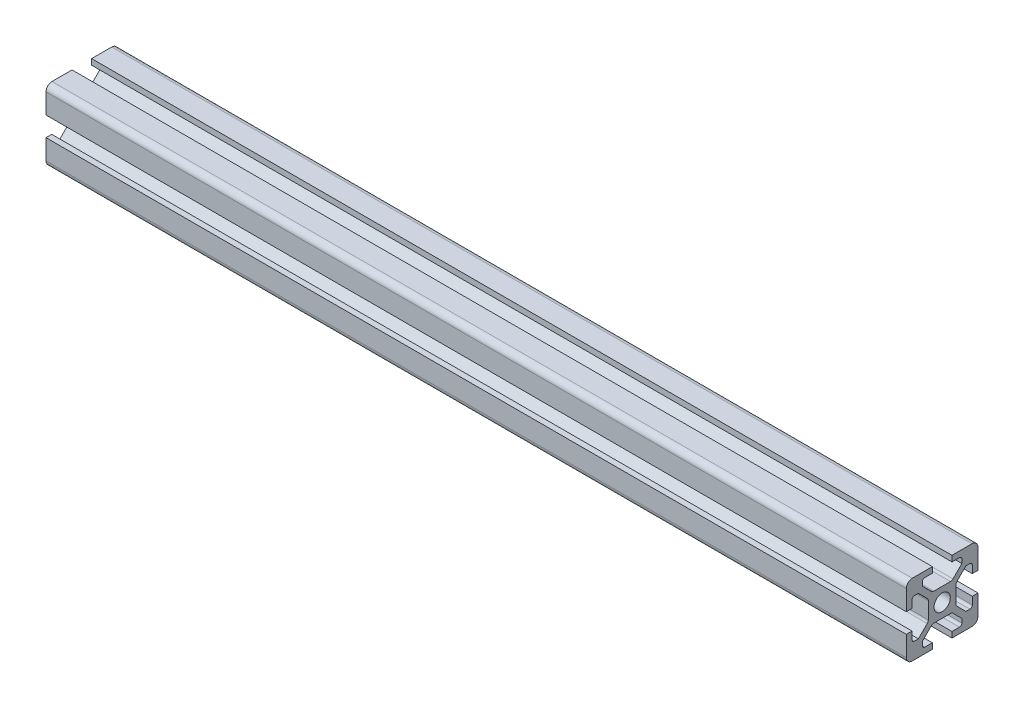
from build123d import *
from build123d.topology import SkipClean

# Parameters (mm, degrees)
SKETCH1_R           = 3.4
BOSS_EXTRUDE2_DEPTH = 100
FILLET5_R           = 2.5
FILLET6_R           = 1.5
FILLET7_R           = 1.5
FILLET8_R           = 1
SKETCH3_R           = 3.4
BOSS_EXTRUDE3_DEPTH = 140
SKETCH7_R           = 3.4
BOSS_EXTRUDE4_DEPTH = 120


with BuildPart() as part:
    # Sketch1 → Boss-Extrude2 (new body)
    with BuildSketch(Plane(origin=(0, 0, 0), x_dir=(0, 0, -1), z_dir=(1, 0, 0))):
        Polygon((10.9, 0), (10.9, 2.4), (6.75, 2.4), (6.75, 5.05), (10.9, 9.2), (19.1, 9.2), (23.25, 5.05), (23.25, 2.4), (19.1, 2.4), (19.1, 0), (30, 0), (30, 10.9), (27.6, 10.9), (27.6, 6.75), (24.95, 6.75), (20.8, 10.9), (20.8, 19.1), (24.95, 23.25), (27.6, 23.25), (27.6, 19.1), (30, 19.1), (30, 30), (19.1, 30), (19.1, 27.6), (23.25, 27.6), (23.25, 24.95), (19.1, 20.8), (10.9, 20.8), (6.75, 24.95), (6.75, 27.6), (10.9, 27.6), (10.9, 30), (0, 30), (0, 19.1), (2.4, 19.1), (2.4, 23.25), (5.05, 23.25), (9.2, 19.1), (9.2, 10.9), (5.05, 6.75), (2.4, 6.75), (2.4, 10.9), (0, 10.9), (0, 0), align=None)
        with Locations((15, 15)):
            Circle(SKETCH1_R, mode=Mode.SUBTRACT)
    extrude(amount=BOSS_EXTRUDE2_DEPTH)

    # Fillet5
    fillet5_edges = [part.edges().sort_by_distance(p)[0] for p in [
        (50, 0, -30),
        (50, 30, -30),
        (50, 0, 0),
        (50, 30, 0),
    ]]
    fillet(fillet5_edges, radius=FILLET5_R)

    # Fillet6
    fillet6_edges = [part.edges().sort_by_distance(p)[0] for p in [
        (50, 19.1, -20.8),
        (50, 10.9, -20.8),
        (50, 9.2, -10.9),
        (50, 9.2, -19.1),
        (50, 10.9, -9.2),
        (50, 19.1, -9.2),
    ]]
    fillet(fillet6_edges, radius=FILLET6_R)

    # Fillet7
    fillet7_edges = [part.edges().sort_by_distance(p)[0] for p in [
        (50, 20.8, -19.1),
        (50, 20.8, -10.9),
    ]]
    fillet(fillet7_edges, radius=FILLET7_R)

    # Fillet8
    fillet8_edges = [part.edges().sort_by_distance(p)[0] for p in [
        (50, 23.25, -2.4),
        (50, 27.6, -6.75),
        (50, 27.6, -23.25),
        (50, 23.25, -27.6),
        (50, 6.75, -27.6),
        (50, 2.4, -23.25),
        (50, 2.4, -6.75),
        (50, 6.75, -2.4),
    ]]
    fillet(fillet8_edges, radius=FILLET8_R)

    # Sketch3 → Boss-Extrude3 (add)
    with BuildSketch(Plane(origin=(0, 0, 0), x_dir=(0, 0, -1), z_dir=(1, 0, 0))):
        with BuildLine():
            Line((10.9, 27.6), (10.9, 30))
            Line((10.9, 30), (2.5, 30))
            ThreePointArc((2.5, 30), (0.732233047, 29.267766953), (0, 27.5))
            Line((0, 27.5), (0, 19.1))
            Line((0, 19.1), (2.4, 19.1))
            Line((2.4, 19.1), (2.4, 22.25))
            ThreePointArc((2.4, 22.25), (2.692893219, 22.957106781), (3.4, 23.25))
            Line((3.4, 23.25), (5.05, 23.25))
            Line((5.05, 23.25), (8.760660172, 19.539339828))
            ThreePointArc((8.760660172, 19.539339828), (9.085819299, 19.052704805), (9.2, 18.478679656))
            Line((9.2, 18.478679656), (9.2, 11.521320344))
            ThreePointArc((9.2, 11.521320344), (9.085819299, 10.947295195), (8.760660172, 10.460660172))
            Line((8.760660172, 10.460660172), (5.05, 6.75))
            Line((5.05, 6.75), (3.4, 6.75))
            ThreePointArc((3.4, 6.75), (2.692893219, 7.042893219), (2.4, 7.75))
            Line((2.4, 7.75), (2.4, 10.9))
            Line((2.4, 10.9), (0, 10.9))
            Line((0, 10.9), (0, 2.5))
            ThreePointArc((0, 2.5), (0.732233047, 0.732233047), (2.5, 0))
            Line((2.5, 0), (10.9, 0))
            Line((10.9, 0), (10.9, 2.4))
            Line((10.9, 2.4), (7.75, 2.4))
            ThreePointArc((7.75, 2.4), (7.042893219, 2.692893219), (6.75, 3.4))
            Line((6.75, 3.4), (6.75, 5.05))
            Line((6.75, 5.05), (10.460660172, 8.760660172))
            ThreePointArc((10.460660172, 8.760660172), (10.947295195, 9.085819299), (11.521320344, 9.2))
            Line((11.521320344, 9.2), (18.478679656, 9.2))
            ThreePointArc((18.478679656, 9.2), (19.052704805, 9.085819299), (19.539339828, 8.760660172))
            Line((19.539339828, 8.760660172), (23.25, 5.05))
            Line((23.25, 5.05), (23.25, 3.4))
            ThreePointArc((23.25, 3.4), (22.957106781, 2.692893219), (22.25, 2.4))
            Line((22.25, 2.4), (19.1, 2.4))
            Line((19.1, 2.4), (19.1, 0))
            Line((19.1, 0), (27.5, 0))
            ThreePointArc((27.5, 0), (29.267766953, 0.732233047), (30, 2.5))
            Line((30, 2.5), (30, 10.9))
            Line((30, 10.9), (27.6, 10.9))
            Line((27.6, 10.9), (27.6, 7.75))
            ThreePointArc((27.6, 7.75), (27.307106781, 7.042893219), (26.6, 6.75))
            Line((26.6, 6.75), (24.95, 6.75))
            Line((24.95, 6.75), (21.239339828, 10.460660172))
            ThreePointArc((21.239339828, 10.460660172), (20.914180701, 10.947295195), (20.8, 11.521320344))
            Line((20.8, 11.521320344), (20.8, 18.478679656))
            ThreePointArc((20.8, 18.478679656), (20.914180701, 19.052704805), (21.239339828, 19.539339828))
            Line((21.239339828, 19.539339828), (24.95, 23.25))
            Line((24.95, 23.25), (26.6, 23.25))
            ThreePointArc((26.6, 23.25), (27.307106781, 22.957106781), (27.6, 22.25))
            Line((27.6, 22.25), (27.6, 19.1))
            Line((27.6, 19.1), (30, 19.1))
            Line((30, 19.1), (30, 27.5))
            ThreePointArc((30, 27.5), (29.267766953, 29.267766953), (27.5, 30))
            Line((27.5, 30), (19.1, 30))
            Line((19.1, 30), (19.1, 27.6))
            Line((19.1, 27.6), (22.25, 27.6))
            ThreePointArc((22.25, 27.6), (22.957106781, 27.307106781), (23.25, 26.6))
            Line((23.25, 26.6), (23.25, 24.95))
            Line((23.25, 24.95), (19.539339828, 21.239339828))
            ThreePointArc((19.539339828, 21.239339828), (19.052704805, 20.914180701), (18.478679656, 20.8))
            Line((18.478679656, 20.8), (11.521320344, 20.8))
            ThreePointArc((11.521320344, 20.8), (10.947295195, 20.914180701), (10.460660172, 21.239339828))
            Line((10.460660172, 21.239339828), (6.75, 24.95))
            Line((6.75, 24.95), (6.75, 26.6))
            ThreePointArc((6.75, 26.6), (7.042893219, 27.307106781), (7.75, 27.6))
            Line((7.75, 27.6), (10.9, 27.6))
        make_face()
        with Locations((15, 15)):
            Circle(SKETCH3_R, mode=Mode.SUBTRACT)
    extrude(amount=-BOSS_EXTRUDE3_DEPTH)

    # Sketch7 → Boss-Extrude4 (add)
    with SkipClean():  # the faces are left unmerged after this step: merging them gives an invalid solid
        with BuildSketch(Plane.ZY.offset(140)):
            with BuildLine():
                Line((-2.4, 10.9), (0, 10.9))
                Line((0, 10.9), (0, 2.5))
                ThreePointArc((0, 2.5), (-0.732233047, 0.732233047), (-2.5, 0))
                Line((-2.5, 0), (-10.9, 0))
                Line((-10.9, 0), (-10.9, 2.4))
                Line((-10.9, 2.4), (-7.75, 2.4))
                ThreePointArc((-7.75, 2.4), (-7.042893219, 2.692893219), (-6.75, 3.4))
                Line((-6.75, 3.4), (-6.75, 5.05))
                Line((-6.75, 5.05), (-10.460660172, 8.760660172))
                ThreePointArc((-10.460660172, 8.760660172), (-10.947295195, 9.085819299), (-11.521320344, 9.2))
                Line((-11.521320344, 9.2), (-18.478679656, 9.2))
                ThreePointArc((-18.478679656, 9.2), (-19.052704805, 9.085819299), (-19.539339828, 8.760660172))
                Line((-19.539339828, 8.760660172), (-23.25, 5.05))
                Line((-23.25, 5.05), (-23.25, 3.4))
                ThreePointArc((-23.25, 3.4), (-22.957106781, 2.692893219), (-22.25, 2.4))
                Line((-22.25, 2.4), (-19.1, 2.4))
                Line((-19.1, 2.4), (-19.1, 0))
                Line((-19.1, 0), (-27.5, 0))
                ThreePointArc((-27.5, 0), (-29.267766953, 0.732233047), (-30, 2.5))
                Line((-30, 2.5), (-30, 10.9))
                Line((-30, 10.9), (-27.6, 10.9))
                Line((-27.6, 10.9), (-27.6, 7.75))
                ThreePointArc((-27.6, 7.75), (-27.307106781, 7.042893219), (-26.6, 6.75))
                Line((-26.6, 6.75), (-24.95, 6.75))
                Line((-24.95, 6.75), (-21.239339828, 10.460660172))
                ThreePointArc((-21.239339828, 10.460660172), (-20.914180701, 10.947295195), (-20.8, 11.521320344))
                Line((-20.8, 11.521320344), (-20.8, 18.478679656))
                ThreePointArc((-20.8, 18.478679656), (-20.914180701, 19.052704805), (-21.239339828, 19.539339828))
                Line((-21.239339828, 19.539339828), (-24.95, 23.25))
                Line((-24.95, 23.25), (-26.6, 23.25))
                ThreePointArc((-26.6, 23.25), (-27.307106781, 22.957106781), (-27.6, 22.25))
                Line((-27.6, 22.25), (-27.6, 19.1))
                Line((-27.6, 19.1), (-30, 19.1))
                Line((-30, 19.1), (-30, 27.5))
                ThreePointArc((-30, 27.5), (-29.267766953, 29.267766953), (-27.5, 30))
                Line((-27.5, 30), (-19.1, 30))
                Line((-19.1, 30), (-19.1, 27.6))
                Line((-19.1, 27.6), (-22.25, 27.6))
                ThreePointArc((-22.25, 27.6), (-22.957106781, 27.307106781), (-23.25, 26.6))
                Line((-23.25, 26.6), (-23.25, 24.95))
                Line((-23.25, 24.95), (-19.539339828, 21.239339828))
                ThreePointArc((-19.539339828, 21.239339828), (-19.052704805, 20.914180701), (-18.478679656, 20.8))
                Line((-18.478679656, 20.8), (-11.521320344, 20.8))
                ThreePointArc((-11.521320344, 20.8), (-10.947295195, 20.914180701), (-10.460660172, 21.239339828))
                Line((-10.460660172, 21.239339828), (-6.75, 24.95))
                Line((-6.75, 24.95), (-6.75, 26.6))
                ThreePointArc((-6.75, 26.6), (-7.042893219, 27.307106781), (-7.75, 27.6))
                Line((-7.75, 27.6), (-10.9, 27.6))
                Line((-10.9, 27.6), (-10.9, 30))
                Line((-10.9, 30), (-2.5, 30))
                ThreePointArc((-2.5, 30), (-0.732233047, 29.267766953), (0, 27.5))
                Line((0, 27.5), (0, 19.1))
                Line((0, 19.1), (-2.4, 19.1))
                Line((-2.4, 19.1), (-2.4, 22.25))
                ThreePointArc((-2.4, 22.25), (-2.692893219, 22.957106781), (-3.4, 23.25))
                Line((-3.4, 23.25), (-5.05, 23.25))
                Line((-5.05, 23.25), (-8.760660172, 19.539339828))
                ThreePointArc((-8.760660172, 19.539339828), (-9.085819299, 19.052704805), (-9.2, 18.478679656))
                Line((-9.2, 18.478679656), (-9.2, 11.521320344))
                ThreePointArc((-9.2, 11.521320344), (-9.085819299, 10.947295195), (-8.760660172, 10.460660172))
                Line((-8.760660172, 10.460660172), (-5.05, 6.75))
                Line((-5.05, 6.75), (-3.4, 6.75))
                ThreePointArc((-3.4, 6.75), (-2.692893219, 7.042893219), (-2.4, 7.75))
                Line((-2.4, 7.75), (-2.4, 10.9))
            make_face()
            with Locations((-15, 15)):
                Circle(SKETCH7_R, mode=Mode.SUBTRACT)
        extrude(amount=BOSS_EXTRUDE4_DEPTH)
    add(part.part.scale(1), mode=Mode.REPLACE)  # the faces are merged on a copy


solid = part.part
